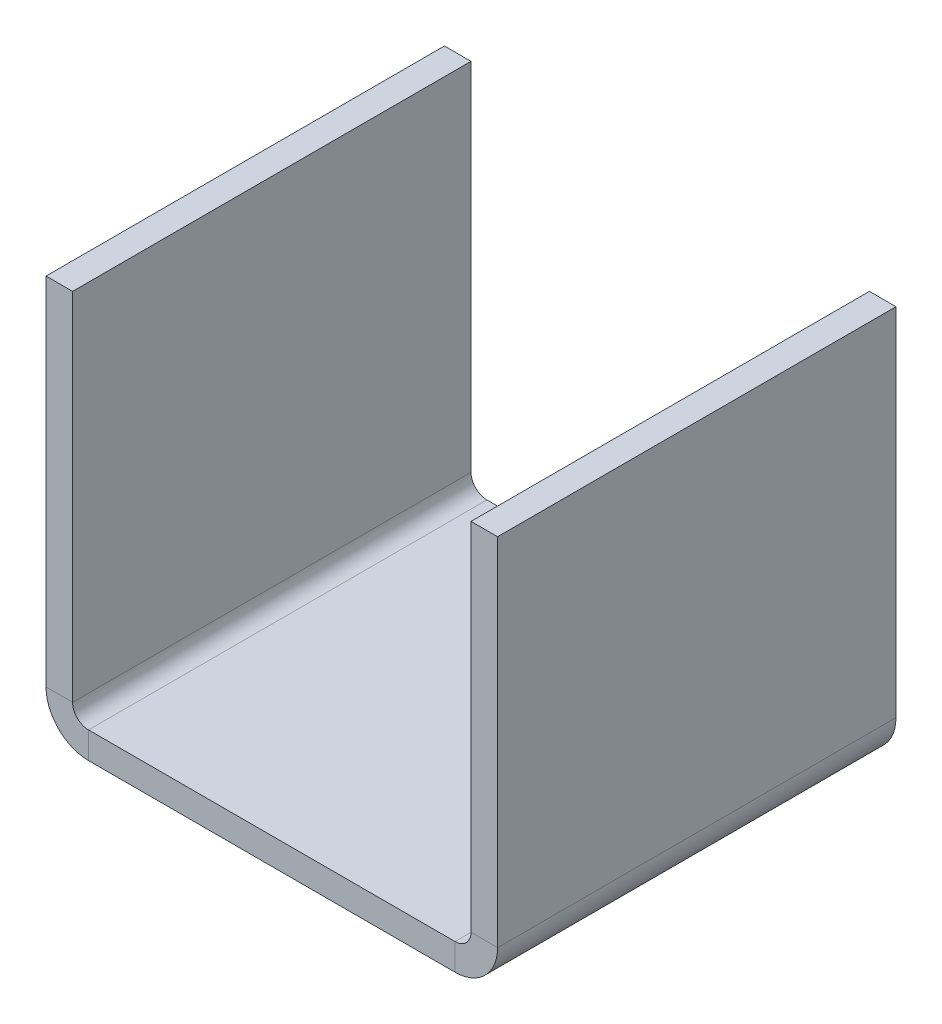
from build123d import *

# Parameters (mm, degrees)
SKETCH1_W               = 27.6
SKETCH1_H               = 30
BASE_FLANGE1_DEPTH      = 2
EDGE_FLANGE1_DEPTH      = 30
EDGE_FLANGE1_BEND_DEPTH = 30


# Sheet-metal steps are written as plain solids
with BuildPart() as part:
    # Sketch1 → Base-Flange1 (new body)
    with BuildSketch(Plane(origin=(0, 0, 0), x_dir=(1, 0, 0), z_dir=(0, 1, 0))):
        Rectangle(SKETCH1_W, SKETCH1_H)
    extrude(amount=-BASE_FLANGE1_DEPTH)

    # Edge-Flange1 section (across the edge) → Edge-Flange1 (add)
    with BuildSketch(Plane(origin=(15, 0, 15), x_dir=(-1, 0, 0), z_dir=(0, 0, -1))):
        with BuildLine():
            Line((-2, 1.2), (-2, 28))
            Line((-2, 28), (0, 28))
            Line((0, 28), (0, 1.2))
            ThreePointArc((0, 1.2), (0.351471863, 0.351471863), (1.2, 0))
            Line((1.2, 0), (1.2, -2))
            ThreePointArc((1.2, -2), (-1.0627417, -1.0627417), (-2, 1.2))
        make_face()
    extrude(amount=EDGE_FLANGE1_DEPTH)

    # Edge-Flange1 section 2 (across the edge) → Edge-Flange1 bend (add)
    with BuildSketch(Plane(origin=(-15, 0, -15), x_dir=(1, 0, 0), z_dir=(0, 0, 1))):
        with BuildLine():
            Line((-2, 1.2), (-2, 28))
            Line((-2, 28), (0, 28))
            Line((0, 28), (0, 1.2))
            ThreePointArc((0, 1.2), (0.351471863, 0.351471863), (1.2, 0))
            Line((1.2, 0), (1.2, -2))
            ThreePointArc((1.2, -2), (-1.0627417, -1.0627417), (-2, 1.2))
        make_face()
    extrude(amount=EDGE_FLANGE1_BEND_DEPTH)


solid = part.part
